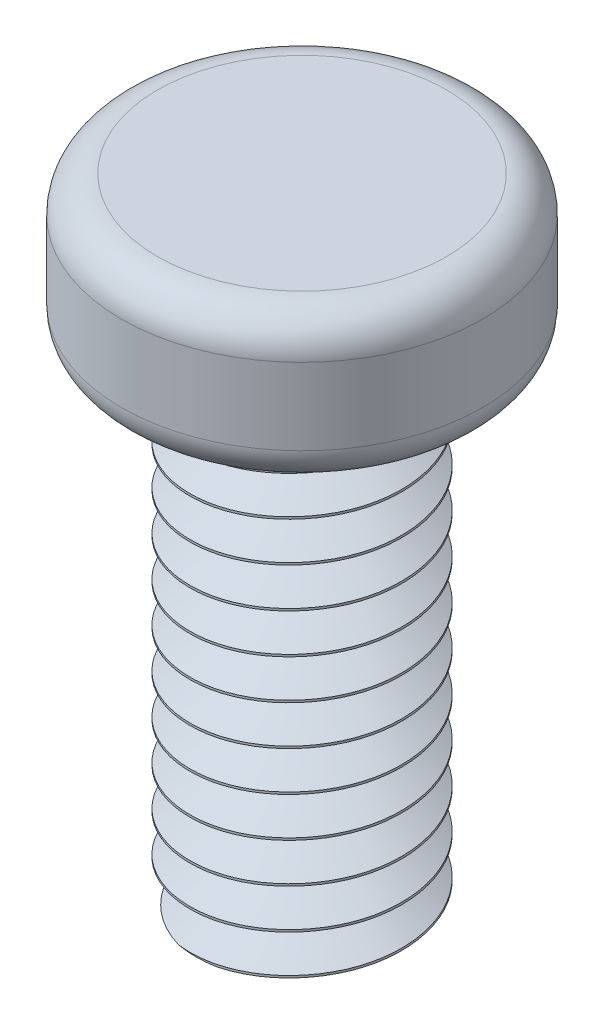
from build123d import *

# Parameters (mm, degrees)
SKETCH1_R           = 2.5
BOSS_EXTRUDE1_DEPTH = 2.06
SKETCH2_R           = 1.47
BOSS_EXTRUDE2_DEPTH = 6.6
CUT_SWEEP1_PITCH    = 0.55
CUT_SWEEP1_TO       = 6.6
FILLET4_R           = 0.5


with BuildPart() as part:
    # Sketch1 → Boss-Extrude1 (new body)
    with BuildSketch(Plane(origin=(0, 0, 0), x_dir=(1, 0, 0), z_dir=(0, 1, 0))):
        with Locations(Location((0, 0, 0), (0, 0, 270))):
            Circle(SKETCH1_R)
    extrude(amount=BOSS_EXTRUDE1_DEPTH)

    # Sketch2 → Boss-Extrude2 (add)
    with BuildSketch(Plane.XZ):
        with Locations(Location((0, 0, 0), (0, 0, 90))):
            Circle(SKETCH2_R)
    extrude(amount=BOSS_EXTRUDE2_DEPTH)

    # Cut-Sweep1: arcs per turn and ends read off the stored shape
    # Cut-Sweep1: the profile of Sketch4 profile screwed along a right-hand helix through 13.666667 turns, 6 arcs to a turn; built about Z, then put on its axis
    cut_sweep1_z = Axis((0, 0, 0), (0, 0, 1))
    cut_sweep1_corners = [(1.01966679, 0, -0.55), (1.4703, 0, -0.289826795), (1.4703, 0, -0.810173205)]
    with BuildLine(mode=Mode.PRIVATE) as cut_sweep1_profile:
        Line(cut_sweep1_corners[0], cut_sweep1_corners[1])
        Line(cut_sweep1_corners[1], cut_sweep1_corners[2])
        Line(cut_sweep1_corners[2], cut_sweep1_corners[0])
    cut_sweep1_cap = Face(cut_sweep1_profile.wire())
    cut_sweep1_turn_angles = [0, 30, 60, 90, 120, 150, 180, 210, 240, 270, 300, 330, 360]
    cut_sweep1_turn_weights = [1, 0.8660254037844387, 1, 0.8660254037844387, 1, 0.8660254037844387, 1, 0.8660254037844387, 1, 0.8660254037844387, 1, 0.8660254037844387, 1]
    cut_sweep1_turn_rails = [Edge.make_bspline([Vector(p[0], p[1], 0).rotate(cut_sweep1_z, cut_sweep1_turn_angles[k]) / cut_sweep1_turn_weights[k] + Vector(0, 0, p[2] + CUT_SWEEP1_PITCH * cut_sweep1_turn_angles[k] / 360) for k in range(13)], [0, 0, 0, 1, 1, 2, 2, 3, 3, 4, 4, 5, 5, 6, 6, 6], 2, cut_sweep1_turn_weights) for p in cut_sweep1_corners]
    cut_sweep1_turn_sides = [Face.make_surface_from_curves(cut_sweep1_turn_rails[p[0]], cut_sweep1_turn_rails[p[1]]) for p in [(0, 1), (1, 2), (2, 0)]]
    cut_sweep1_last_angles = [4680, 4710, 4740, 4770, 4800, 4830, 4860, 4890, 4920]
    cut_sweep1_last_weights = [1, 0.8660254037844387, 1, 0.8660254037844387, 1, 0.8660254037844387, 1, 0.8660254037844387, 1]
    cut_sweep1_last_rails = [Edge.make_bspline([Vector(p[0], p[1], 0).rotate(cut_sweep1_z, cut_sweep1_last_angles[k]) / cut_sweep1_last_weights[k] + Vector(0, 0, p[2] + CUT_SWEEP1_PITCH * cut_sweep1_last_angles[k] / 360) for k in range(9)], [0, 0, 0, 1, 1, 2, 2, 3, 3, 4, 4, 4], 2, cut_sweep1_last_weights) for p in cut_sweep1_corners]
    cut_sweep1_last_sides = [Face.make_surface_from_curves(cut_sweep1_last_rails[p[0]], cut_sweep1_last_rails[p[1]]) for p in [(0, 1), (1, 2), (2, 0)]]
    cut_sweep1 = Plane(origin=(0, -6.6, 0), x_dir=(0, 0, -1), z_dir=(0, 1, 0)) * split(Solid(Shell([*[p.moved(Location((0, 0, CUT_SWEEP1_PITCH * i))) for i in range(13) for p in cut_sweep1_turn_sides], *cut_sweep1_last_sides, cut_sweep1_cap, cut_sweep1_cap.rotate(cut_sweep1_z, 4920).moved(Location((0, 0, CUT_SWEEP1_PITCH * 4920 / 360)))])), bisect_by=Plane.XY.offset(CUT_SWEEP1_TO), keep=Keep.BOTTOM, mode=Mode.PRIVATE)
    add(cut_sweep1, mode=Mode.SUBTRACT)

    # Fillet4
    fillet4_edges = [part.edges().sort_by_distance(p)[0] for p in [
        (0, 0, -2.5),
        (0, 2.06, -2.5),
    ]]
    fillet(fillet4_edges, radius=FILLET4_R)


solid = part.part
